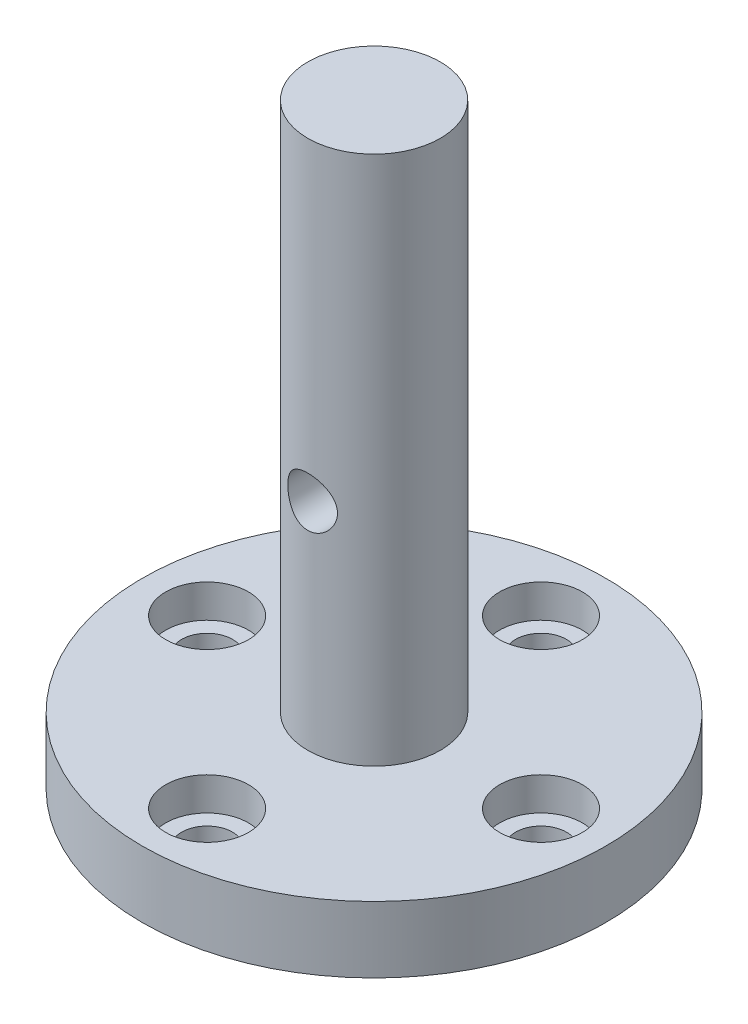
from build123d import *

# Parameters (mm, degrees)
SKETCH1_R                       = 11.1125
BOSS_EXTRUDE1_DEPTH             = 3.175
SKETCH2_R                       = 3.175
BOSS_EXTRUDE2_DEPTH             = 25.4
F_2_CLEARANCE_HOLE1_D           = 2.4384
SKETCH5_R                       = 1.984375
CUT_EXTRUDE1_DEPTH              = 1.5875
F_3_32_0_09375_DIAMETER_HOLE1_D = 2.38125


with BuildPart() as part:
    # Sketch1 → Boss-Extrude1 (new body)
    with BuildSketch(Plane(origin=(0, 0, 0), x_dir=(1, 0, 0), z_dir=(0, 1, 0))):
        Circle(SKETCH1_R)
    extrude(amount=BOSS_EXTRUDE1_DEPTH)

    # Sketch2 → Boss-Extrude2 (add)
    with BuildSketch(Plane(origin=(0, 3.175, 0), x_dir=(1, 0, 0), z_dir=(0, 1, 0))):
        Circle(SKETCH2_R)
    extrude(amount=BOSS_EXTRUDE2_DEPTH)

    # #2 Clearance Hole1 (through all)
    with Locations(Plane(origin=(0, 3.175, 0), x_dir=(1, 0, 0), z_dir=(0, 1, 0))):
        with Locations((0, -8), (0, 8), (-8, 0), (8, 0)):
            Hole(F_2_CLEARANCE_HOLE1_D / 2)

    # Sketch5 → Cut-Extrude1 (cut)
    with BuildSketch(Plane(origin=(0, 3.175, 0), x_dir=(1, 0, 0), z_dir=(0, 1, 0))):
        with Locations((0, -8)):
            Circle(SKETCH5_R)
        with Locations((8, 0)):
            Circle(SKETCH5_R)
        with Locations((0, 8)):
            Circle(SKETCH5_R)
        with Locations((-8, 0)):
            Circle(SKETCH5_R)
    extrude(amount=-CUT_EXTRUDE1_DEPTH, mode=Mode.SUBTRACT)

    # 3/32 (0.09375) Diameter Hole1 (through all)
    with Locations(Plane.XY.offset(3.175)):
        with Locations((0, 13.49375)):
            Hole(F_3_32_0_09375_DIAMETER_HOLE1_D / 2)


solid = part.part
